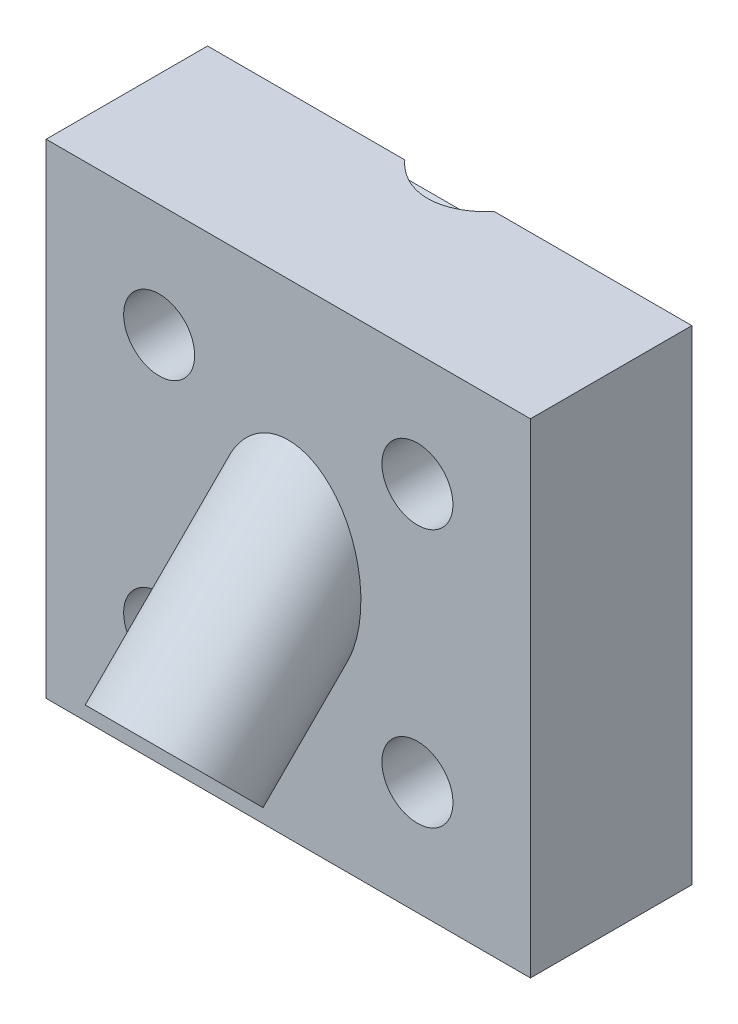
from build123d import *
from build123d.topology import SkipClean

# Parameters (mm, degrees)
SKETCH1_W            = 15
SKETCH1_H            = 15
SKETCH1_R            = 1.1
EXTRUDE1_DEPTH       = 4
EXTRUDE2_DEPTH       = 60
EXTRUDE2_DEPTH_BACK  = 4
SKETCH3_R            = 2
SKETCH4_R            = 1.75
EXTRUDE3_DEPTH       = 3
SKETCH5_R            = 2
EXTRUDE4_DEPTH       = 3
SKETCH9_R            = 0.5
EXTRUDE8_DEPTH       = 63
EXTRUDE_START        = 1
SKETCH_4_W           = 15
SKETCH_4_H           = 15
SKETCH_4_R           = 1.1
EXTRUDE_1_DEPTH      = 1
SKETCH_3_R           = 1.5
CUT_EXTRUDE_2_DEPTH  = 104
SKETCH_5_W           = 63.20966087
SKETCH_5_H           = 58.197081521
CUT_EXTRUDE_3_DEPTH  = 40
EXTRUDE_2_DEPTH      = 5
EXTRUDE_2_DEPTH_BACK = 10
SKETCH_6_R           = 2.25
SKETCH_6_R_2         = 1.5
CUT_EXTRUDE_START    = -1.5
SKETCH_7_R           = 2.25
CUT_EXTRUDE_4_DEPTH  = 1.5


with BuildPart() as part:
    # Sketch1 → Extrude1 (new body)
    with BuildSketch(Plane.XY):
        with Locations((7.5, -7.5)):
            Rectangle(SKETCH1_W, SKETCH1_H)
        with Locations((3.5, -3.5)):
            Circle(SKETCH1_R, mode=Mode.SUBTRACT)
        with Locations((11.5, -3.5)):
            Circle(SKETCH1_R, mode=Mode.SUBTRACT)
        with Locations((11.5, -11.5)):
            Circle(SKETCH1_R, mode=Mode.SUBTRACT)
        with Locations((3.5, -11.5)):
            Circle(SKETCH1_R, mode=Mode.SUBTRACT)
    extrude(amount=EXTRUDE1_DEPTH)

    # Sketch3 → Extrude2 (add, two sides: drawn at the far end of the back side and taken through both)
    with BuildSketch(Plane(origin=(0, -5.75, 5.75), x_dir=(1, 0, 0), z_dir=(0, -0.7071067811865488, 0.7071067811865464)).offset(-EXTRUDE2_DEPTH_BACK)):
        with Locations(Location((7.5, -2.474873734, 0), (0, 0, 270))):
            Circle(SKETCH3_R)
    extrude(amount=EXTRUDE2_DEPTH + EXTRUDE2_DEPTH_BACK)

    # Sketch4 → Extrude3 (add)
    with BuildSketch(Plane(origin=(0, -48.176406871, 48.176406871), x_dir=(1, 0, 0), z_dir=(0, -0.7071067811865487, 0.7071067811865465))):
        with Locations(Location((7.5, -2.474873734, 0), (0, 0, 90))):
            Circle(SKETCH4_R)
    extrude(amount=EXTRUDE3_DEPTH)

    # Sketch5 → Extrude4 (add)
    with BuildSketch(Plane(origin=(0, -50.297727215, 50.297727215), x_dir=(-1, 0, 0), z_dir=(0, -0.7071067811865486, 0.7071067811865465))):
        with Locations(Location((-7.5, 2.474873734, 0), (0, 0, 90))):
            Circle(SKETCH5_R)
    extrude(amount=EXTRUDE4_DEPTH)

    # Sketch9 → Extrude8 (cut)
    with BuildSketch(Plane(origin=(0, 0, 0), x_dir=(0, 0, -1), z_dir=(1, 0, 0))):
        with Locations(Location((-47.487067043, -50.987067043, 0), (0, 0, 180))):
            Circle(SKETCH9_R)
    extrude(amount=EXTRUDE8_DEPTH, mode=Mode.SUBTRACT)

    # 草图4 → 凸台-拉伸1 (add)
    with SkipClean():  # the faces are left unmerged after this step: merging them gives an invalid solid
        with BuildSketch(Plane(origin=(0, 0, 0), x_dir=(-1, 0, 0), z_dir=(0, 0, -1)).offset(EXTRUDE_START)):
            with Locations((-7.5, -7.5)):
                Rectangle(SKETCH_4_W, SKETCH_4_H)
            with Locations((-3.5, -3.5)):
                Circle(SKETCH_4_R, mode=Mode.SUBTRACT)
            with Locations((-11.5, -3.5)):
                Circle(SKETCH_4_R, mode=Mode.SUBTRACT)
            with Locations((-11.5, -11.5)):
                Circle(SKETCH_4_R, mode=Mode.SUBTRACT)
            with Locations((-3.5, -11.5)):
                Circle(SKETCH_4_R, mode=Mode.SUBTRACT)
        extrude(amount=-EXTRUDE_1_DEPTH)

    # 草图3 → 切除-拉伸2 (cut)
    with BuildSketch(Plane(origin=(0, -52.419047558, 52.419047558), x_dir=(1, 0, 0), z_dir=(0, -0.7071067811865487, 0.7071067811865465))):
        with Locations(Location((7.5, -2.474873734, 0), (0, 0, 270))):
            Circle(SKETCH_3_R)
    extrude(amount=-CUT_EXTRUDE_2_DEPTH, mode=Mode.SUBTRACT)

    # 草图5 → 切除-拉伸3 (cut)
    with SkipClean():  # the faces are left unmerged after this step: merging them gives an invalid solid
        with BuildSketch(Plane(origin=(15, 0, 0), x_dir=(0, 0, -1), z_dir=(1, 0, 0))):
            with Locations((-35.604830435, -29.098540761)):
                Rectangle(SKETCH_5_W, SKETCH_5_H)
        extrude(amount=-CUT_EXTRUDE_3_DEPTH, mode=Mode.SUBTRACT)
    add(part.part.scale(1), mode=Mode.REPLACE)  # the faces are merged on a copy

    # 草图6 → 凸台-拉伸2 (add, two sides: drawn at the far end of the back side and taken through both)
    with BuildSketch(Plane(origin=(0, -5.75, 5.75), x_dir=(1, 0, 0), z_dir=(0, -0.7071067811865488, 0.7071067811865464)).offset(-EXTRUDE_2_DEPTH_BACK)):
        with Locations(Location((7.5, -2.474873734, 0), (0, 0, 270))):
            Circle(SKETCH_6_R)
        with Locations(Location((7.5, -2.474873734, 0), (0, 0, 270))):
            Circle(SKETCH_6_R_2, mode=Mode.SUBTRACT)
    extrude(amount=EXTRUDE_2_DEPTH + EXTRUDE_2_DEPTH_BACK)

    # 草图7 → 切除-拉伸4 (cut)
    with SkipClean():  # the faces are left unmerged after this step: merging them gives an invalid solid
        with BuildSketch(Plane(origin=(0, 1.321067812, -1.321067812), x_dir=(1, 0, 0), z_dir=(0, 0.7071067811865487, -0.7071067811865465)).offset(CUT_EXTRUDE_START)):
            with Locations(Location((7.5, 2.474873734, 0), (0, 0, 90))):
                Circle(SKETCH_7_R)
        extrude(amount=CUT_EXTRUDE_4_DEPTH, mode=Mode.SUBTRACT)


solid = part.part
